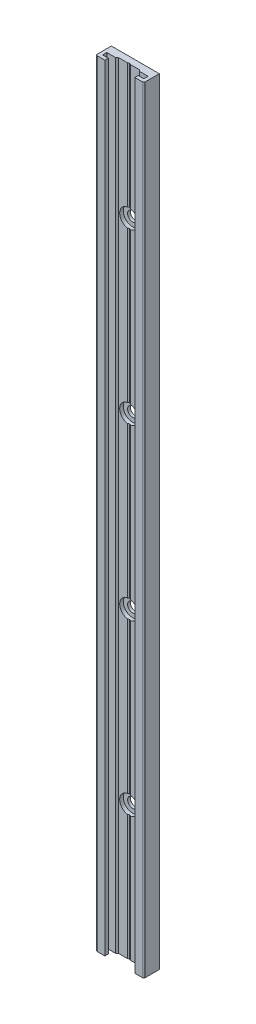
from build123d import *

# Parameters (mm, degrees)
BOSS_EXTRUDE1_DEPTH = 275
LPATTERN1_COUNT     = 4
LPATTERN1_PITCH     = 60


with BuildPart() as part:
    # Sketch1 → Boss-Extrude1 (new body)
    with BuildSketch(Plane(origin=(0, 137.5, 0), x_dir=(1, 0, 0), z_dir=(0, 1, 0))):
        with BuildLine():
            Line((-8.5, 0), (-8.5, -5))
            ThreePointArc((-8.5, -5), (-8.353553391, -5.353553391), (-8, -5.5))
            Line((-8, -5.5), (-5.3, -5.5))
            Line((-5.3, -5.5), (-5.3, -4.3))
            Line((-5.3, -4.3), (-7.3, -4.3))
            Line((-7.3, -4.3), (-7.3, -2.8))
            Line((-7.3, -2.8), (-4.25, -2.8))
            Line((-4.25, -2.8), (-3.75, -2.3))
            Line((-3.75, -2.3), (-0.5, -2.3))
            Line((-0.5, -2.3), (-2e-09, -2.011324867))
            Line((-2e-09, -2.011324867), (0.5, -2.3))
            Line((0.5, -2.3), (3.75, -2.3))
            Line((3.75, -2.3), (4.25, -2.8))
            Line((4.25, -2.8), (7.3, -2.8))
            Line((7.3, -2.8), (7.3, -4.3))
            Line((7.3, -4.3), (5.3, -4.3))
            Line((5.3, -4.3), (5.3, -5.5))
            Line((5.3, -5.5), (8, -5.5))
            ThreePointArc((8, -5.5), (8.353553391, -5.353553391), (8.5, -5))
            Line((8.5, -5), (8.5, 0))
            Line((8.5, 0), (-8.5, 0))
        make_face()
    extrude(amount=-BOSS_EXTRUDE1_DEPTH)

    # Sketch2 → Cut-Revolve1 (revolve, cut)
    with BuildSketch(Plane(origin=(0, -90, 0), x_dir=(1, 0, 0), z_dir=(0, 1, 0))):
        Polygon((1.75, 0), (0, 0), (0, -2.3), (3.25, -2.3), (3.25, -1), (1.75, -1), align=None)
    cut_revolve1 = revolve(axis=Axis((0, -90, 0), (0, 0, 1)), mode=Mode.SUBTRACT)

    # LPattern1: Cut-Revolve1 ×4
    with Locations(*[(0, i * LPATTERN1_PITCH, 0) for i in range(1, LPATTERN1_COUNT)]):
        add(cut_revolve1, mode=Mode.SUBTRACT)


solid = part.part
